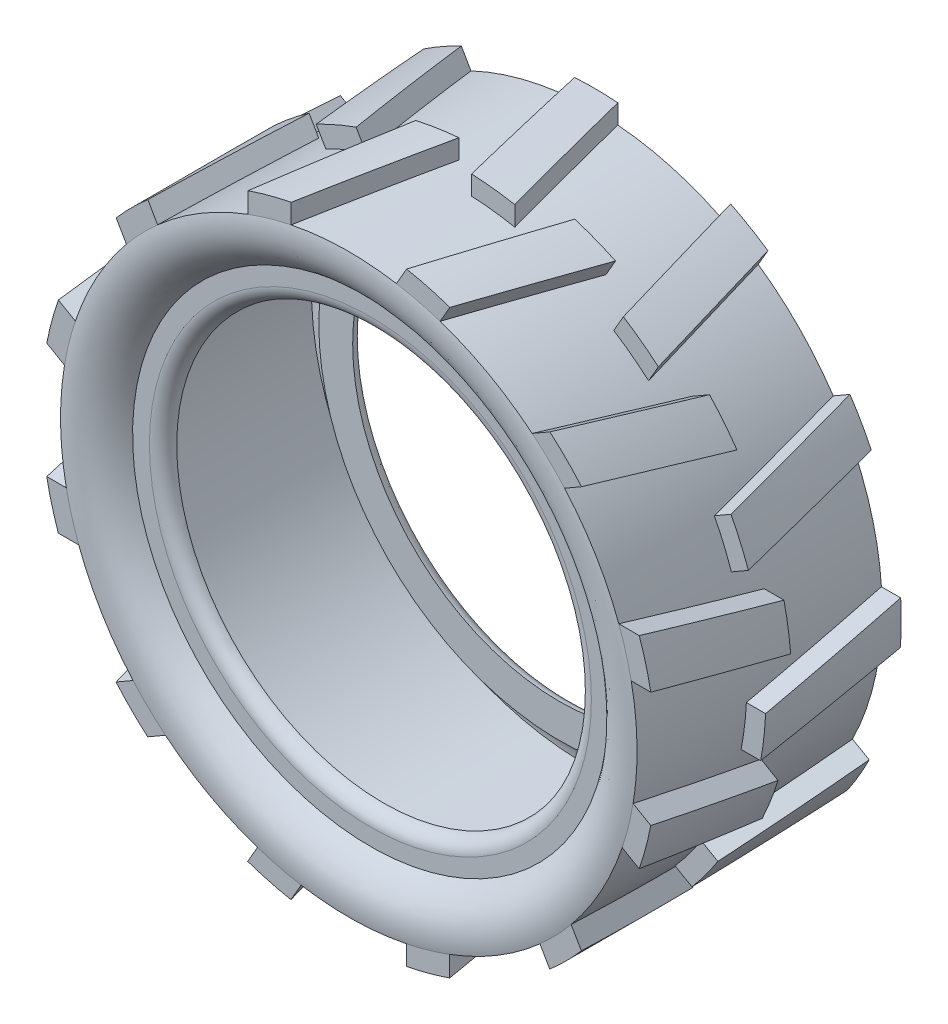
from build123d import *

# Parameters (mm, degrees)
EXTRUDE_1_REACH          = 143.027
EXTRUDE_1_END_RADIUS     = 60
PATTERN_CIRCULAR_1_COUNT = 12
CUT_EXTRUDE_1_DEPTH      = 106.398238127
CUT_EXTRUDE_1_DEPTH_BACK = 106.398238127
SKETCH_3_R               = 81.642849203
SKETCH_3_R_2             = 64


with BuildPart() as part:
    # Эскиз1 → Повернуть1 (revolve)
    with BuildSketch(Plane(origin=(0, 0, 0), x_dir=(0, 0, -1), z_dir=(1, 0, 0))):
        with BuildLine():
            Line((0, 60), (25.5, 60))
            add(Edge.make_bspline(
                [(25.5, 60), (26.87392414, 53.731531383), (21, 49.5)],
                knots=[0, 0, 0, 1, 1, 1], degree=2))
            Line((21, 49.5), (21, 46))
            ThreePointArc((21, 46), (20.233438311, 43.981012926), (18.309499833, 43))
            Line((18.309499833, 43), (18.309499833, 46))
            Line((18.309499833, 46), (18.309499833, 50.052245881))
            Line((18.309499833, 50.052245881), (19.830971021, 51.122766541))
            add(Edge.make_bspline(
                [(23.727210277, 57.000001924), (23.698095797, 56.695947897), (23.549438985, 55.802338787), (23.114489215, 54.672185135), (22.402847503, 53.561439088), (21.715390804, 52.73438959), (20.880135901, 51.926289864), (20.180202764, 51.374350498), (19.830971021, 51.122766541)],
                knots=[0.266180621, 0.266180621, 0.266180621, 0.266180621, 0.367957178, 0.578638119, 0.683978589, 0.789319059, 0.89465953, 1, 1, 1, 1], degree=3))
            Line((23.727210277, 57.000001924), (0, 57.000001924))
            Line((0, 57.000001924), (-23.727247353, 57))
            add(Edge.make_bspline(
                [(-23.727247353, 57), (-23.698095969, 56.695948927), (-23.549439173, 55.802339274), (-23.114489215, 54.672185135), (-22.402847503, 53.561439088), (-21.715390804, 52.73438959), (-20.880135901, 51.926289864), (-20.180202764, 51.374350498), (-19.830971021, 51.122766541)],
                knots=[0.266180441, 0.266180441, 0.266180441, 0.266180441, 0.367957178, 0.578638119, 0.683978589, 0.789319059, 0.89465953, 1, 1, 1, 1], degree=3))
            Line((-19.830971021, 51.122766541), (-18.309499833, 50.052245881))
            Line((-18.309499833, 50.052245881), (-18.309499833, 46))
            Line((-18.309499833, 46), (-18.309499833, 43))
            ThreePointArc((-18.309499833, 43), (-20.233438311, 43.981012926), (-21, 46))
            Line((-21, 46), (-21, 49.5))
            add(Edge.make_bspline(
                [(-25.5, 60), (-26.87392414, 53.731531383), (-21, 49.5)],
                knots=[0, 0, 0, 1, 1, 1], degree=2))
            Line((-25.5, 60), (0, 60))
        make_face()
    revolve(axis=Axis((0, 0, 131.047552284), (0, 0, -1)))

    # Бобышка-Вытянуть1: up to this cylinder (the profile starts outside it)
    extrude_1_end = Plane(origin=(0, 0, 0), z_dir=(0, 0, 1)) * Cylinder(EXTRUDE_1_END_RADIUS, 429.86818, mode=Mode.PRIVATE)
    # Эскиз2 → Бобышка-Вытянуть1 (add, up to the surface)
    with BuildSketch(Plane(origin=(0, 65, 0), x_dir=(1, 0, 0), z_dir=(0, 1, 0)), mode=Mode.PRIVATE) as extrude_1_sk1:
        Polygon((-5.259945351, 2.685820354), (-12, -25.5), (-21, -25.5), (-14.259945351, 2.685820354), align=None)
    extrude_1_tool1 = extrude(extrude_1_sk1.sketch, amount=-EXTRUDE_1_REACH, mode=Mode.PRIVATE) - extrude_1_end
    # Эскиз2 → Бобышка-Вытянуть1 (add, up to the surface)
    with BuildSketch(Plane(origin=(0, 65, 0), x_dir=(1, 0, 0), z_dir=(0, 1, 0)), mode=Mode.PRIVATE) as extrude_1_sk2:
        Polygon((5, 25.5), (-4, 25.5), (2.740054649, -2.685820354), (11.740054649, -2.685820354), align=None)
    extrude_1_tool2 = extrude(extrude_1_sk2.sketch, amount=-EXTRUDE_1_REACH, mode=Mode.PRIVATE) - extrude_1_end
    extrude_1 = extrude_1_tool1.solids().sort_by_distance((-13.129973, 65, 11.40709))[0] + extrude_1_tool2.solids().sort_by_distance((3.870027, 65, -11.40709))[0]
    add(extrude_1)

    # Круговой массив1: Бобышка-Вытянуть1 ×12 about axis
    pattern_circular_1_axis = Axis((0, 0, 131.047552284), (0, 0, 1))
    for i in range(1, PATTERN_CIRCULAR_1_COUNT):
        add(extrude_1.rotate(pattern_circular_1_axis, i * 360 / PATTERN_CIRCULAR_1_COUNT))

    # Эскиз3 → Вырез-Вытянуть1 (cut, two sides: drawn at the far end of the back side and taken through both)
    with BuildSketch(Plane.XY.offset(21).offset(-CUT_EXTRUDE_1_DEPTH_BACK)):
        Circle(SKETCH_3_R)
        Circle(SKETCH_3_R_2, mode=Mode.SUBTRACT)
    extrude(amount=CUT_EXTRUDE_1_DEPTH + CUT_EXTRUDE_1_DEPTH_BACK, mode=Mode.SUBTRACT)


solid = part.part
